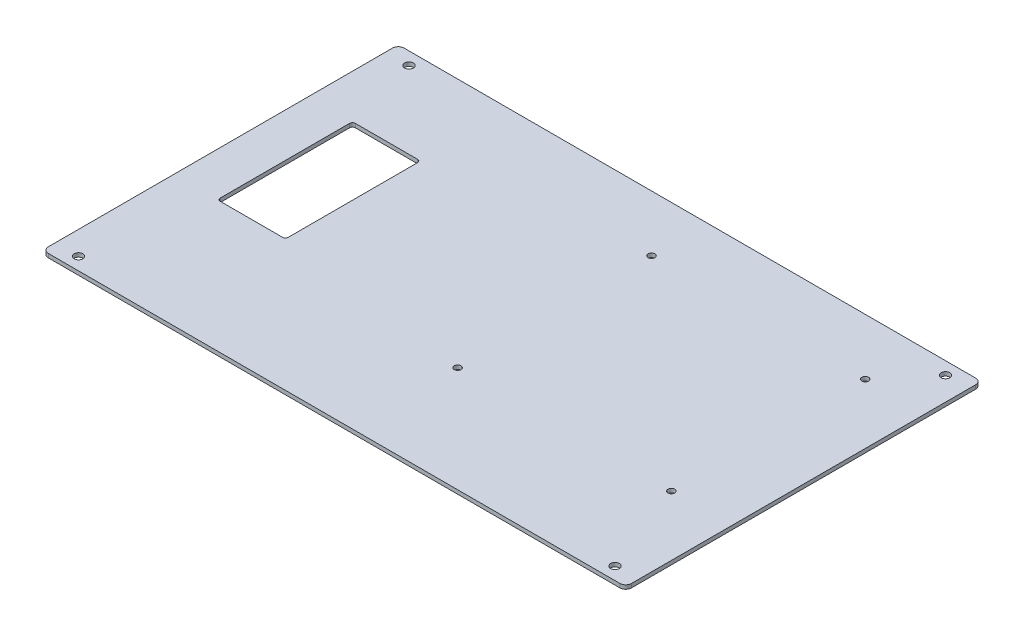
from build123d import *

# Parameters (mm, degrees)
BASE_FLANGE2_DEPTH = 2
SKETCH2_R          = 2.25
CUT_EXTRUDE4_DEPTH = 10
CUT_EXTRUDE3_DEPTH = 10
CUT_EXTRUDE5_DEPTH = 10


# Sheet-metal steps are written as plain solids
with BuildPart() as part:
    # Sketch1 → Base-Flange2 (new body)
    with BuildSketch(Plane(origin=(0, 0, 0), x_dir=(1, 0, 0), z_dir=(0, 1, 0))):
        with BuildLine():
            Line((164.634355994, -145.755690278), (-129.365644006, -145.755690278))
            ThreePointArc((-129.365644006, -145.755690278), (-131.486964349, -144.877010621), (-132.365644006, -142.755690278))
            Line((-132.365644006, -142.755690278), (-132.365644006, 34.244309722))
            ThreePointArc((-132.365644006, 34.244309722), (-131.486964349, 36.365630066), (-129.365644006, 37.244309722))
            Line((-129.365644006, 37.244309722), (164.634355994, 37.244309722))
            ThreePointArc((164.634355994, 37.244309722), (166.755676338, 36.365630066), (167.634355994, 34.244309722))
            Line((167.634355994, 34.244309722), (167.634355994, -142.755690278))
            ThreePointArc((167.634355994, -142.755690278), (166.755676338, -144.877010621), (164.634355994, -145.755690278))
        make_face()
    extrude(amount=-BASE_FLANGE2_DEPTH)

    # Sketch2 → Cut-Extrude4 (cut)
    with BuildSketch(Plane(origin=(0, 0, 0), x_dir=(1, 0, 0), z_dir=(0, 1, 0))):
        with Locations(Location((-120.365644006, 30.744309722, 0), (0, 0, 270))):
            Circle(SKETCH2_R)
        with Locations(Location((-120.365644006, -139.255690278, 0), (0, 0, 270))):
            Circle(SKETCH2_R)
        with Locations(Location((155.634355994, -139.255690278, 0), (0, 0, 270))):
            Circle(SKETCH2_R)
        with Locations(Location((155.634355994, 30.744309722, 0), (0, 0, 270))):
            Circle(SKETCH2_R)
    extrude(amount=-CUT_EXTRUDE4_DEPTH, mode=Mode.SUBTRACT)

    # Sketch3 → Cut-Extrude3 (cut)
    with BuildSketch(Plane(origin=(0, 0, 0), x_dir=(1, 0, 0), z_dir=(0, 1, 0))):
        with BuildLine():
            Line((-107.836218664, -8.834875742), (-76.368346069, -8.834873742))
            ThreePointArc((-76.368346069, -8.834873742), (-75.307684442, -9.274214133), (-74.868344006, -10.334875742))
            Line((-74.868344006, -10.334875742), (-74.868344006, -76.822675742))
            ThreePointArc((-74.868344006, -76.822675742), (-75.307683834, -77.883335913), (-76.368344006, -78.322675742))
            Line((-76.368344006, -78.322675742), (-76.895069411, -78.322675742))
            Line((-76.895069411, -78.322675742), (-107.836218601, -78.322675742))
            Line((-107.836218601, -78.322675742), (-108.362944006, -78.322675742))
            ThreePointArc((-108.362944006, -78.322675742), (-109.423604177, -77.883335913), (-109.862944006, -76.822675742))
            Line((-109.862944006, -76.822675742), (-109.862944006, -10.334875742))
            ThreePointArc((-109.862944006, -10.334875742), (-109.423604177, -9.27421557), (-108.362944006, -8.834875742))
            Line((-108.362944006, -8.834875742), (-107.836218664, -8.834875742))
        make_face()
    extrude(amount=-CUT_EXTRUDE3_DEPTH, mode=Mode.SUBTRACT)

    # Sketch6 → Cut-Extrude5 (cut)
    with BuildSketch(Plane(origin=(0, 0, 0), x_dir=(1, 0, 0), z_dir=(0, 1, 0))):
        with BuildLine():
            add(Edge.make_bspline(
                [(28.521903533, -91.386017736), (28.521903533, -91.158613657), (28.431436566, -90.7038055), (28.044994377, -90.125453892), (27.466642769, -89.739011703), (26.784430533, -89.603311252), (26.102218297, -89.739011703), (25.52386669, -90.125453892), (25.1374245, -90.7038055), (25.00172405, -91.386017736), (25.1374245, -92.068229972), (25.52386669, -92.646581579), (26.102218297, -93.033023768), (26.784430533, -93.168724219), (27.466642769, -93.033023768), (28.044994377, -92.646581579), (28.431436566, -92.068229972), (28.521903533, -91.613421814), (28.521903533, -91.386017736)],
                knots=[0, 0, 0, 0, 0.0625, 0.125, 0.1875, 0.25, 0.3125, 0.375, 0.4375, 0.5, 0.5625, 0.625, 0.6875, 0.75, 0.8125, 0.875, 0.9375, 1, 1, 1, 1], degree=3))
        make_face()
        with BuildLine():
            add(Edge.make_bspline(
                [(138.471903533, 8.363982264), (138.471903533, 8.591386343), (138.381436566, 9.0461945), (137.994994377, 9.624546108), (137.416642769, 10.010988297), (136.734430533, 10.146688748), (136.052218297, 10.010988297), (135.47386669, 9.624546108), (135.0874245, 9.0461945), (134.95172405, 8.363982264), (135.0874245, 7.681770028), (135.47386669, 7.103418421), (136.052218297, 6.716976232), (136.734430533, 6.581275781), (137.416642769, 6.716976232), (137.994994377, 7.103418421), (138.381436566, 7.681770028), (138.471903533, 8.136578186), (138.471903533, 8.363982264)],
                knots=[0, 0, 0, 0, 0.0625, 0.125, 0.1875, 0.25, 0.3125, 0.375, 0.4375, 0.5, 0.5625, 0.625, 0.6875, 0.75, 0.8125, 0.875, 0.9375, 1, 1, 1, 1], degree=3))
        make_face()
        with BuildLine():
            add(Edge.make_bspline(
                [(28.521903533, 8.363982264), (28.521903533, 8.591386343), (28.431436566, 9.0461945), (28.044994377, 9.624546108), (27.466642769, 10.010988297), (26.784430533, 10.146688748), (26.102218297, 10.010988297), (25.52386669, 9.624546108), (25.1374245, 9.0461945), (25.00172405, 8.363982264), (25.1374245, 7.681770028), (25.52386669, 7.103418421), (26.102218297, 6.716976232), (26.784430533, 6.581275781), (27.466642769, 6.716976232), (28.044994377, 7.103418421), (28.431436566, 7.681770028), (28.521903533, 8.136578186), (28.521903533, 8.363982264)],
                knots=[0, 0, 0, 0, 0.0625, 0.125, 0.1875, 0.25, 0.3125, 0.375, 0.4375, 0.5, 0.5625, 0.625, 0.6875, 0.75, 0.8125, 0.875, 0.9375, 1, 1, 1, 1], degree=3))
        make_face()
        with BuildLine():
            add(Edge.make_bspline(
                [(138.471903533, -91.386017736), (138.471903533, -91.158613657), (138.381436566, -90.7038055), (137.994994377, -90.125453892), (137.416642769, -89.739011703), (136.734430533, -89.603311252), (136.052218297, -89.739011703), (135.47386669, -90.125453892), (135.0874245, -90.7038055), (134.95172405, -91.386017736), (135.0874245, -92.068229972), (135.47386669, -92.646581579), (136.052218297, -93.033023768), (136.734430533, -93.168724219), (137.416642769, -93.033023768), (137.994994377, -92.646581579), (138.381436566, -92.068229972), (138.471903533, -91.613421814), (138.471903533, -91.386017736)],
                knots=[0, 0, 0, 0, 0.0625, 0.125, 0.1875, 0.25, 0.3125, 0.375, 0.4375, 0.5, 0.5625, 0.625, 0.6875, 0.75, 0.8125, 0.875, 0.9375, 1, 1, 1, 1], degree=3))
        make_face()
    extrude(amount=-CUT_EXTRUDE5_DEPTH, mode=Mode.SUBTRACT)


solid = part.part
